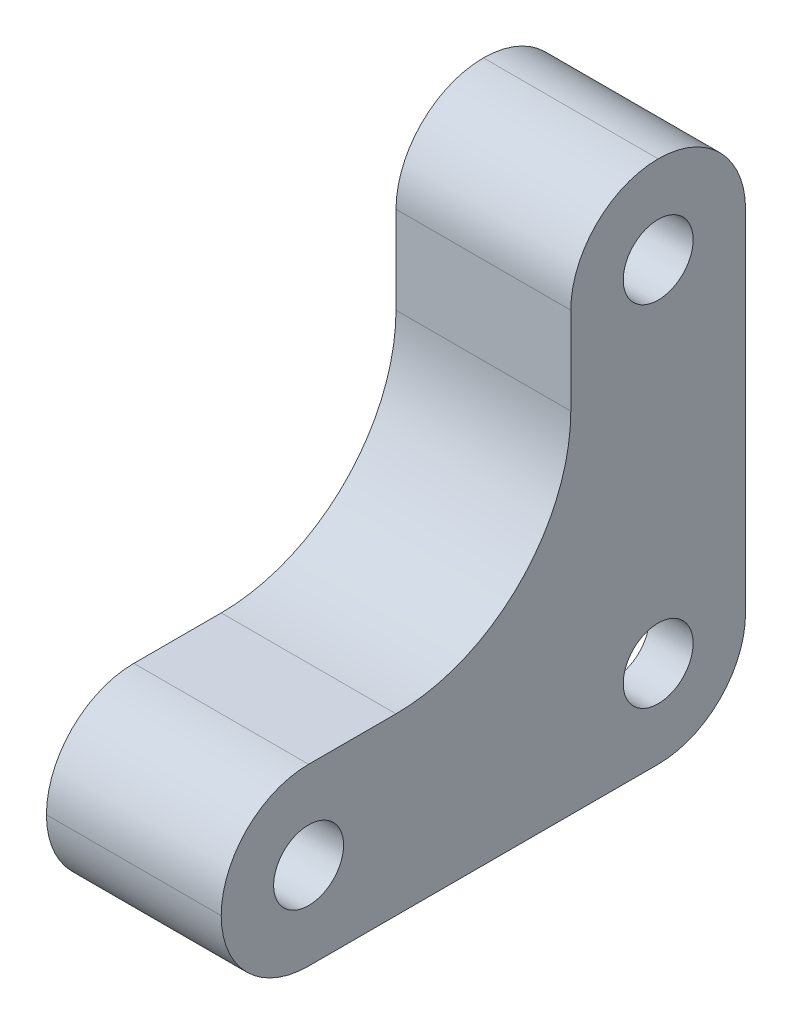
from build123d import *

# Parameters (mm, degrees)
SKETCH1_W           = 10
SKETCH1_H           = 30
BOSS_EXTRUDE1_DEPTH = 10
SKETCH2_W           = 10
SKETCH2_H           = 10
BOSS_EXTRUDE2_DEPTH = 20
SKETCH3_R           = 2
CUT_EXTRUDE1_DEPTH  = 36
FILLET1_R           = 5
FILLET2_R           = 10
SKETCH6_W           = 5
SKETCH6_H           = 10
CUT_EXTRUDE3_DEPTH  = 10
CHAMFER1_SIZE       = 10
SKETCH4_R           = 2
CUT_EXTRUDE4_DEPTH  = 36
FILLET3_R           = 5


with BuildPart() as part:
    # Sketch1 → Boss-Extrude1 (new body)
    with BuildSketch(Plane(origin=(0, 0, 0), x_dir=(1, 0, 0), z_dir=(0, 1, 0))):
        Rectangle(SKETCH1_W, SKETCH1_H)
    extrude(amount=BOSS_EXTRUDE1_DEPTH)

    # Sketch2 → Boss-Extrude2 (add)
    with BuildSketch(Plane(origin=(0, 10, 0), x_dir=(1, 0, 0), z_dir=(0, 1, 0))):
        with Locations((0, 10)):
            Rectangle(SKETCH2_W, SKETCH2_H)
    extrude(amount=BOSS_EXTRUDE2_DEPTH)

    # Sketch3 → Cut-Extrude1 (cut, through all)
    with BuildSketch(Plane(origin=(5, 0, 0), x_dir=(0, 0, -1), z_dir=(1, 0, 0))):
        with Locations((-10, 5)):
            Circle(SKETCH3_R)
        with Locations((10, 25)):
            Circle(SKETCH3_R)
    extrude(amount=-CUT_EXTRUDE1_DEPTH, mode=Mode.SUBTRACT)

    # Fillet1
    fillet1_edges = [part.edges().sort_by_distance(p)[0] for p in [
        (0, 30, -15),
        (0, 30, -5),
        (0, 0, 15),
        (0, 10, 15),
    ]]
    fillet(fillet1_edges, radius=FILLET1_R - 0.0001)  # a hair under: the kernel refuses the full size

    # Fillet2
    fillet2_edges = [part.edges().sort_by_distance(p)[0] for p in [
        (0, 10, -5),
    ]]
    fillet(fillet2_edges, radius=FILLET2_R)

    # Sketch6 → Cut-Extrude3 (cut)
    with BuildSketch(Plane(origin=(0, 0, -15), x_dir=(-1, 0, 0), z_dir=(0, 0, -1))):
        with Locations((0, 5)):
            Rectangle(SKETCH6_W, SKETCH6_H)
    extrude(amount=-CUT_EXTRUDE3_DEPTH, mode=Mode.SUBTRACT)

    # Chamfer1
    chamfer1_edges = [part.edges().sort_by_distance(p)[0] for p in [
        (0, 0, -5),
        (0, 10, -15),
    ]]
    chamfer(chamfer1_edges, length=CHAMFER1_SIZE - 0.0001)  # a hair under: the kernel refuses the full size

    # Sketch4 → Cut-Extrude4 (cut, through all)
    with BuildSketch(Plane(origin=(5, 0, 0), x_dir=(0, 0, -1), z_dir=(1, 0, 0))):
        with Locations((10, 5)):
            Circle(SKETCH4_R)
    extrude(amount=-CUT_EXTRUDE4_DEPTH, mode=Mode.SUBTRACT)

    # Fillet3
    fillet3_edges = [part.edges().sort_by_distance(p)[0] for p in [
        (3.75, 0, -15),
        (-3.75, 0, -15),
    ]]
    fillet(fillet3_edges, radius=FILLET3_R)


solid = part.part
